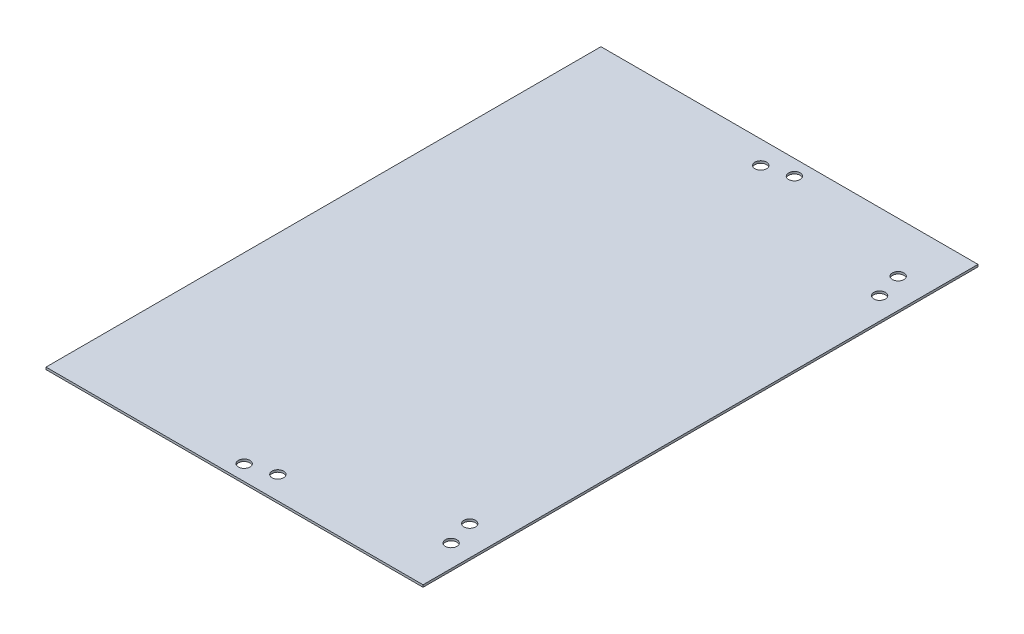
from build123d import *

# Parameters (mm, degrees)
SKETCH3_W           = 220
SKETCH3_H           = 323.8
BOSS_EXTRUDE1_DEPTH = 1.2954
CUT_EXTRUDE1_REACH  = 197.738
SKETCH4_R           = 3.3782


with BuildPart() as part:
    # Sketch3 → Boss-Extrude1 (new body)
    with BuildSketch(Plane(origin=(0, 0, 0), x_dir=(1, 0, 0), z_dir=(0, 1, 0))):
        Rectangle(SKETCH3_W, SKETCH3_H)
    extrude(amount=BOSS_EXTRUDE1_DEPTH)

    # Sketch4 → Cut-Extrude1 (cut, up to next)
    with BuildSketch(Plane(origin=(0, 1.2954, 0), x_dir=(1, 0, 0), z_dir=(0, 1, 0)), mode=Mode.PRIVATE) as cut_extrude1_sk1:
        with Locations((97.1046, -132.62)):
            Circle(SKETCH4_R)
    cut_extrude1_tool1 = extrude(cut_extrude1_sk1.sketch, amount=-CUT_EXTRUDE1_REACH, mode=Mode.PRIVATE) & part.part
    # Sketch4 → Cut-Extrude1 (cut, up to next)
    with BuildSketch(Plane(origin=(0, 1.2954, 0), x_dir=(1, 0, 0), z_dir=(0, 1, 0)), mode=Mode.PRIVATE) as cut_extrude1_sk2:
        with Locations((92.7046, -117.38)):
            Circle(SKETCH4_R)
    cut_extrude1_tool2 = extrude(cut_extrude1_sk2.sketch, amount=-CUT_EXTRUDE1_REACH, mode=Mode.PRIVATE) & part.part
    # Sketch4 → Cut-Extrude1 (cut, up to next)
    with BuildSketch(Plane(origin=(0, 1.2954, 0), x_dir=(1, 0, 0), z_dir=(0, 1, 0)), mode=Mode.PRIVATE) as cut_extrude1_sk3:
        with Locations((11.8746, -148.5)):
            Circle(SKETCH4_R)
    cut_extrude1_tool3 = extrude(cut_extrude1_sk3.sketch, amount=-CUT_EXTRUDE1_REACH, mode=Mode.PRIVATE) & part.part
    # Sketch4 → Cut-Extrude1 (cut, up to next)
    with BuildSketch(Plane(origin=(0, 1.2954, 0), x_dir=(1, 0, 0), z_dir=(0, 1, 0)), mode=Mode.PRIVATE) as cut_extrude1_sk4:
        with Locations((-3.3654, -152.9)):
            Circle(SKETCH4_R)
    cut_extrude1_tool4 = extrude(cut_extrude1_sk4.sketch, amount=-CUT_EXTRUDE1_REACH, mode=Mode.PRIVATE) & part.part
    # Sketch4 → Cut-Extrude1 (cut, up to next)
    with BuildSketch(Plane(origin=(0, 1.2954, 0), x_dir=(1, 0, 0), z_dir=(0, 1, 0)), mode=Mode.PRIVATE) as cut_extrude1_sk5:
        with Locations((97.1046, 117.38)):
            Circle(SKETCH4_R)
    cut_extrude1_tool5 = extrude(cut_extrude1_sk5.sketch, amount=-CUT_EXTRUDE1_REACH, mode=Mode.PRIVATE) & part.part
    # Sketch4 → Cut-Extrude1 (cut, up to next)
    with BuildSketch(Plane(origin=(0, 1.2954, 0), x_dir=(1, 0, 0), z_dir=(0, 1, 0)), mode=Mode.PRIVATE) as cut_extrude1_sk6:
        with Locations((92.7046, 132.62)):
            Circle(SKETCH4_R)
    cut_extrude1_tool6 = extrude(cut_extrude1_sk6.sketch, amount=-CUT_EXTRUDE1_REACH, mode=Mode.PRIVATE) & part.part
    # Sketch4 → Cut-Extrude1 (cut, up to next)
    with BuildSketch(Plane(origin=(0, 1.2954, 0), x_dir=(1, 0, 0), z_dir=(0, 1, 0)), mode=Mode.PRIVATE) as cut_extrude1_sk7:
        with Locations((11.8746, 152.9)):
            Circle(SKETCH4_R)
    cut_extrude1_tool7 = extrude(cut_extrude1_sk7.sketch, amount=-CUT_EXTRUDE1_REACH, mode=Mode.PRIVATE) & part.part
    # Sketch4 → Cut-Extrude1 (cut, up to next)
    with BuildSketch(Plane(origin=(0, 1.2954, 0), x_dir=(1, 0, 0), z_dir=(0, 1, 0)), mode=Mode.PRIVATE) as cut_extrude1_sk8:
        with Locations((-3.3654, 148.5)):
            Circle(SKETCH4_R)
    cut_extrude1_tool8 = extrude(cut_extrude1_sk8.sketch, amount=-CUT_EXTRUDE1_REACH, mode=Mode.PRIVATE) & part.part
    add(cut_extrude1_tool1.solids().sort_by_distance((97.1046, 1.2954, 132.62))[0], mode=Mode.SUBTRACT)
    add(cut_extrude1_tool2.solids().sort_by_distance((92.7046, 1.2954, 117.38))[0], mode=Mode.SUBTRACT)
    add(cut_extrude1_tool3.solids().sort_by_distance((11.8746, 1.2954, 148.5))[0], mode=Mode.SUBTRACT)
    add(cut_extrude1_tool4.solids().sort_by_distance((-3.3654, 1.2954, 152.9))[0], mode=Mode.SUBTRACT)
    add(cut_extrude1_tool5.solids().sort_by_distance((97.1046, 1.2954, -117.38))[0], mode=Mode.SUBTRACT)
    add(cut_extrude1_tool6.solids().sort_by_distance((92.7046, 1.2954, -132.62))[0], mode=Mode.SUBTRACT)
    add(cut_extrude1_tool7.solids().sort_by_distance((11.8746, 1.2954, -152.9))[0], mode=Mode.SUBTRACT)
    add(cut_extrude1_tool8.solids().sort_by_distance((-3.3654, 1.2954, -148.5))[0], mode=Mode.SUBTRACT)


solid = part.part
